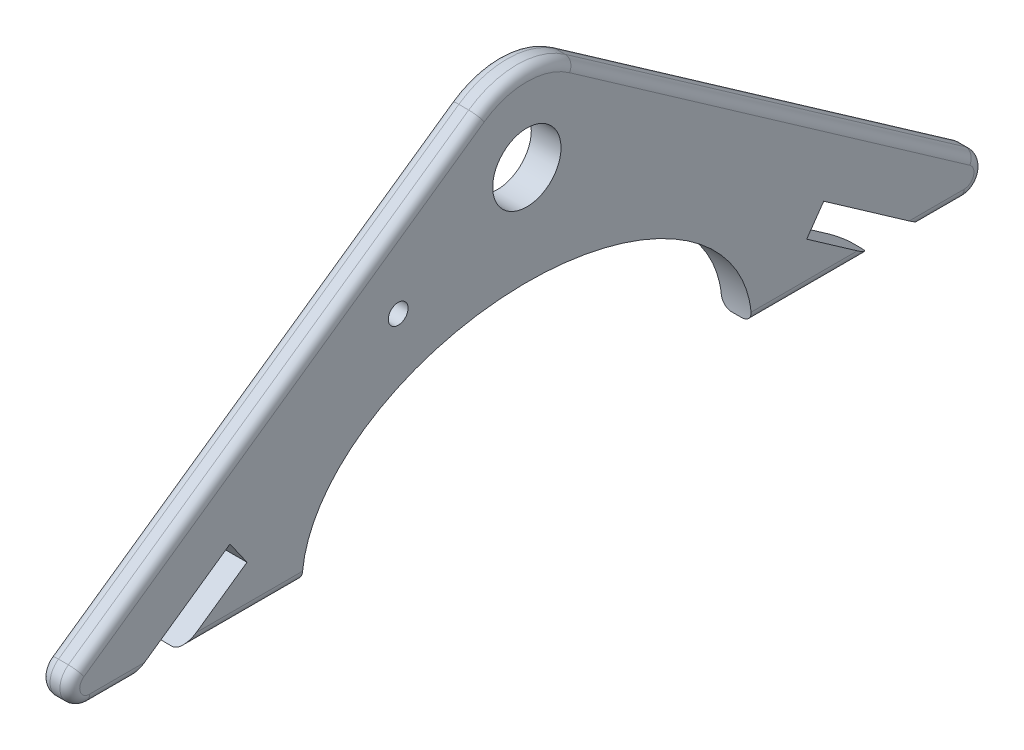
from build123d import *

# Parameters (mm, degrees)
SKETCH1_R           = 3.45
SKETCH1_R_2         = 1
BOSS_EXTRUDE1_DEPTH = 3
FILLET1_R           = 1


with BuildPart() as part:
    # Sketch1 → Boss-Extrude1 (new body)
    with BuildSketch(Plane(origin=(0, 0, 0), x_dir=(0, 0, -1), z_dir=(1, 0, 0))):
        with BuildLine():
            Line((-4.875399709, 6.962792376), (-45.326961199, -21.361695911))
            ThreePointArc((-45.326961199, -21.361695911), (-46.087242228, -23.601411599), (-44.179808327, -25))
            Line((-44.179808327, -25), (-40.062317158, -25))
            Line((-40.062317158, -25), (-29.999489725, -17.953932376))
            Line((-29.999489725, -17.953932376), (-28.278760416, -20.411388509))
            Line((-28.278760416, -20.411388509), (-34.831976771, -25))
            Line((-34.831976771, -25), (-22.712020043, -25))
            add(Edge.make_bspline(
                [(22.712020043, -25), (22.712020043, -10.040084051), (0, -10.040084051), (-22.712020043, -10.040084051), (-22.712020043, -25)],
                knots=[3.141592654, 3.141592654, 3.141592654, 4.71238898, 4.71238898, 6.283185307, 6.283185307, 6.283185307], degree=2, weights=[1, 0.707106781, 1, 0.707106781, 1]))
            Line((22.712020043, -25), (34.831976771, -25))
            Line((34.831976771, -25), (28.278760416, -20.411388509))
            Line((28.278760416, -20.411388509), (29.999489725, -17.953932376))
            Line((29.999489725, -17.953932376), (40.062317158, -25))
            Line((40.062317158, -25), (44.179808327, -25))
            ThreePointArc((44.179808327, -25), (46.087242228, -23.601411599), (45.326961199, -21.361695911))
            Line((45.326961199, -21.361695911), (4.875399709, 6.962792376))
            ThreePointArc((4.875399709, 6.962792376), (0, 8.5), (-4.875399709, 6.962792376))
        make_face()
        Circle(SKETCH1_R, mode=Mode.SUBTRACT)
        with Locations((-13.000951064, -6.30696214)):
            Circle(SKETCH1_R_2, mode=Mode.SUBTRACT)
    extrude(amount=BOSS_EXTRUDE1_DEPTH)

    # Fillet1
    fillet1_edges = [part.edges().sort_by_distance(p)[0] for p in [
        (0, -25, -42.121062742),
        (0, -7.199451767, -25.101180454),
        (0, 8.5, 0),
        (0, -25, 42.121062742),
        (3, -25, -42.121062742),
        (3, -7.199451767, -25.101180454),
        (3, 8.5, 0),
        (3, -25, 42.121062742),
        (0, -25, -28.771998407),
        (3, -25, -28.771998407),
        (0, -25, 28.771998407),
        (3, -25, 28.771998407),
        (0, -7.199451767, 25.101180454),
        (3, -7.199451767, 25.101180454),
        (0, -23.601411599, -46.087242228),
        (0, -23.601411599, 46.087242228),
        (3, -23.601411599, -46.087242228),
        (3, -23.601411599, 46.087242228),
    ]]
    fillet(fillet1_edges, radius=FILLET1_R)


solid = part.part
